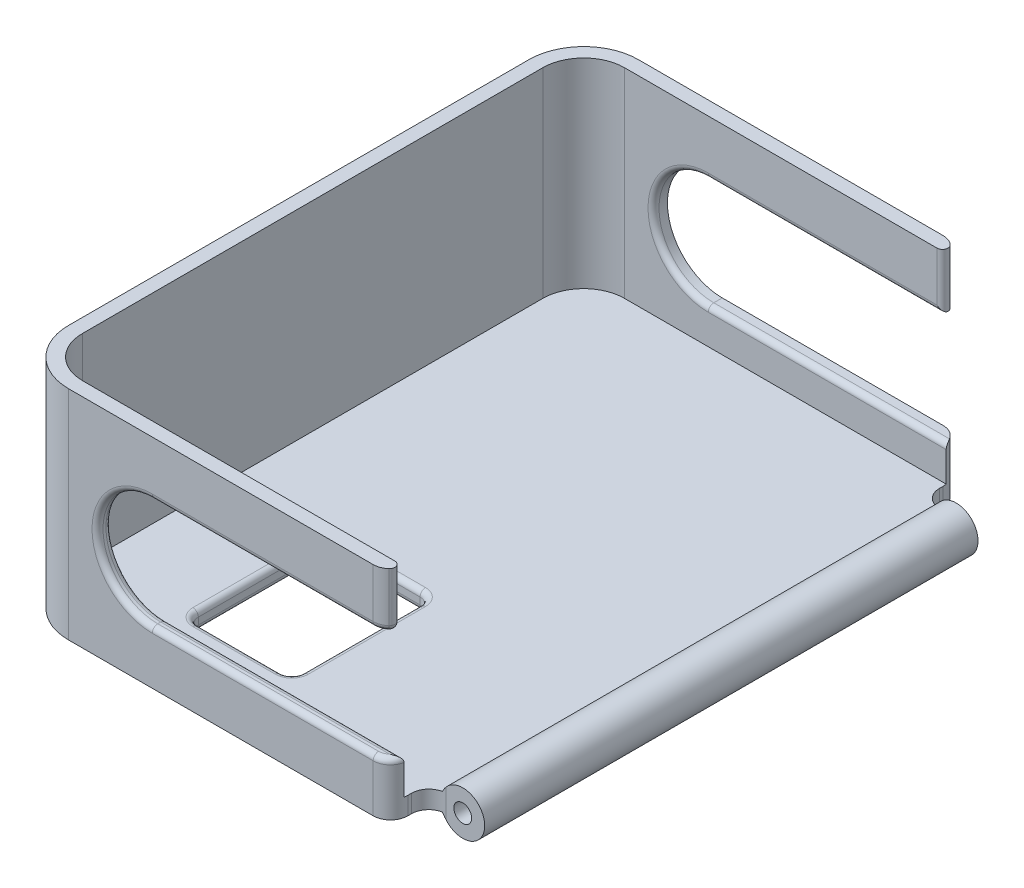
from build123d import *

# Parameters (mm, degrees)
SKETCH1_R                       = 4
BOSS_EXTRUDE1_DEPTH             = 45
SKETCH2_R                       = 1.625
BOSS_EXTRUDE2_DEPTH             = 2
FILLET1_R                       = 1
FILLET1_OF_MIRROR1_R            = 1
BOSS_EXTRUDE3_REACH             = 49.339
BOSS_EXTRUDE3_DIRECTION_2_REACH = 49.339
SKETCH5_W                       = 68.734952121
SKETCH5_H                       = 6.985
BOSS_EXTRUDE4_DEPTH             = 3.25
FILLET2_R                       = 3.175
FILLET3_R                       = 10
BOSS_EXTRUDE5_DEPTH             = 36.449
SKETCH7_W                       = 19.05
SKETCH7_H                       = 25.4
CUT_EXTRUDE1_DEPTH              = 33.782
FILLET4_R                       = 2
CUT_EXTRUDE2_DEPTH              = 134.693288074
CUT_EXTRUDE3_DEPTH              = 99.825981407
CUT_EXTRUDE3_DEPTH_BACK         = 99.825981407
SKETCH13_R                      = 1.625
SKETCH14_W                      = 22.869052137
SKETCH14_H                      = 20
CUT_EXTRUDE4_DEPTH              = 134.693288074
FILLET5_R                       = 1


with BuildPart() as part:
    # Sketch1 → Boss-Extrude1 (new, symmetric)
    with BuildSketch(Plane.XY):
        with Locations(Location((0, 0, 0), (0, 0, 180))):
            Circle(SKETCH1_R)
    extrude(amount=BOSS_EXTRUDE1_DEPTH, both=True)

    # Sketch2 → Boss-Extrude2 (add)
    with BuildSketch(Plane.XY.offset(45)):
        Circle(SKETCH2_R)
    boss_extrude2 = extrude(amount=BOSS_EXTRUDE2_DEPTH)

    # Fillet1
    fillet1_edges = [part.edges().sort_by_distance(p)[0] for p in [
        (-1.625, 0, 47),
    ]]
    fillet(fillet1_edges, radius=FILLET1_R)

    # Mirror1: Boss-Extrude2 across plane
    add(boss_extrude2.mirror(Plane.XY))

    # Fillet1 of Mirror1
    fillet1_of_mirror1_edges = [part.edges().sort_by_distance(p)[0] for p in [
        (-1.625, 0, -47),
    ]]
    fillet(fillet1_of_mirror1_edges, radius=FILLET1_OF_MIRROR1_R)

    # Boss-Extrude3: up to this face of the body (flat: up to its plane)
    boss_extrude3_end = Plane(part.part.faces().sort_by_distance((3.886862915, 0, 45))[0])
    # Sketch3 → Boss-Extrude3 (add, up to the picked face)
    with BuildSketch(Plane.XY, mode=Mode.PRIVATE) as boss_extrude3_sk1:
        Polygon((0, 0), (0, 1.625), (-74.93, 1.625), (-74.93, -1.625), (0, -1.625), align=None)
    boss_extrude3_tool1 = split(extrude(boss_extrude3_sk1.sketch, amount=BOSS_EXTRUDE3_REACH, mode=Mode.PRIVATE), bisect_by=boss_extrude3_end, keep=Keep.BOTH, mode=Mode.PRIVATE)
    add(boss_extrude3_tool1.solids().sort_by(Axis((-37.465, 0, 0), (0, 0, 1)))[0])

    # Boss-Extrude3 direction 2: up to this face of the body (flat: up to its plane)
    boss_extrude3_direction_2_end = Plane(part.part.faces().sort_by_distance((3.886862915, 0, -45))[0])
    # Sketch3 → Boss-Extrude3 direction 2 (add, up to the picked face)
    with BuildSketch(Plane.XY, mode=Mode.PRIVATE) as boss_extrude3_direction_2_sk1:
        Polygon((0, 0), (0, 1.625), (-74.93, 1.625), (-74.93, -1.625), (0, -1.625), align=None)
    boss_extrude3_direction_2_tool1 = split(extrude(boss_extrude3_direction_2_sk1.sketch, amount=-BOSS_EXTRUDE3_DIRECTION_2_REACH, mode=Mode.PRIVATE), bisect_by=boss_extrude3_direction_2_end, keep=Keep.BOTH, mode=Mode.PRIVATE)
    add(boss_extrude3_direction_2_tool1.solids().sort_by(Axis((-37.465, 0, 0), (0, 0, -1)))[0])

    # Sketch5 → Boss-Extrude4 (add)
    with BuildSketch(Plane(origin=(0, 1.625, 0), x_dir=(1, 0, 0), z_dir=(0, 1, 0))):
        with Locations((-40.56252394, 48.4925)):
            Rectangle(SKETCH5_W, SKETCH5_H)
    boss_extrude4 = extrude(amount=-BOSS_EXTRUDE4_DEPTH)

    # Mirror2: Boss-Extrude4 across plane
    add(boss_extrude4.mirror(Plane.XY))

    # Fillet2
    # the kernel refuses this fillet: 3.175 mm, written as the material it adds along each edge
    with BuildSketch(Plane(origin=(-6.195047879, 1.625, -45), x_dir=(1, 0, 0), z_dir=(0, -1, 0))) as fillet2_piece_1_section:
        with BuildLine():
            CenterArc((FILLET2_R, -FILLET2_R), FILLET2_R, 90, 90)
            Line((0, -FILLET2_R), (0, 0))
            Line((0, 0), (FILLET2_R, 0))
        make_face()
    fillet2_piece_1 = extrude(amount=3.25, mode=Mode.PRIVATE)
    fillet2_piece_1 = fillet2_piece_1 - Plane(origin=(0, 0, -45.745349648), x_dir=(-1, 0, 0), z_dir=(0, 0, 1)) * Cylinder(4, 20, mode=Mode.PRIVATE)
    add(fillet2_piece_1)
    with BuildSketch(Plane(origin=(-6.195047879, 9.5625, -45), x_dir=(1, 0, 0), z_dir=(0, -1, 0))) as fillet2_piece_2_section:
        with BuildLine():
            CenterArc((FILLET2_R, -FILLET2_R), FILLET2_R, 90, 90)
            Line((0, -FILLET2_R), (0, 0))
            Line((0, 0), (FILLET2_R, 0))
        make_face()
    fillet2_piece_2 = extrude(amount=11.1875, mode=Mode.PRIVATE)
    fillet2_piece_2 = split(fillet2_piece_2, bisect_by=Plane(origin=(-3.269448726, 1.625, -44.97522317), z_dir=(0, 1, 0)), keep=Keep.TOP, mode=Mode.PRIVATE)
    fillet2_piece_2 = fillet2_piece_2 & Plane(origin=(0, 0, -44.97522317), x_dir=(-1, 0, 0), z_dir=(0, 0, 1)) * Cylinder(4, 36, mode=Mode.PRIVATE)
    add(fillet2_piece_2)
    with BuildSketch(Plane(origin=(-6.195047879, 1.625, -45), x_dir=(1, 0, 0), z_dir=(0, -1, 0))) as fillet2_piece_3_section:
        with BuildLine():
            CenterArc((FILLET2_R, -FILLET2_R), FILLET2_R, 90, 90)
            Line((0, -FILLET2_R), (0, 0))
            Line((0, 0), (FILLET2_R, 0))
        make_face()
    fillet2_piece_3 = extrude(amount=3.25, mode=Mode.PRIVATE)
    fillet2_piece_3 = fillet2_piece_3 & Plane(origin=(0, 0, -44.99635319), x_dir=(-1, 0, 0), z_dir=(0, 0, 1)) * Cylinder(4, 20, mode=Mode.PRIVATE)
    add(fillet2_piece_3)
    with BuildSketch(Plane(origin=(-6.195047879, 1.625, -45), x_dir=(1, 0, 0), z_dir=(0, -1, 0))) as fillet2_piece_4_section:
        with BuildLine():
            CenterArc((FILLET2_R, -FILLET2_R), FILLET2_R, 90, 90)
            Line((0, -FILLET2_R), (0, 0))
            Line((0, 0), (FILLET2_R, 0))
        make_face()
    fillet2_piece_4 = extrude(amount=11.1875, mode=Mode.PRIVATE)
    fillet2_piece_4 = split(fillet2_piece_4, bisect_by=Plane(origin=(-3.269448726, -1.625, -44.97522317), z_dir=(0, -1, 0)), keep=Keep.TOP, mode=Mode.PRIVATE)
    fillet2_piece_4 = fillet2_piece_4 & Plane(origin=(0, 0, -44.97522317), x_dir=(-1, 0, 0), z_dir=(0, 0, 1)) * Cylinder(4, 36, mode=Mode.PRIVATE)
    add(fillet2_piece_4)
    with BuildSketch(Plane(origin=(-6.195047879, 1.625, 45), x_dir=(1, 0, 0), z_dir=(0, -1, 0))) as fillet2_piece_5_section:
        with BuildLine():
            CenterArc((FILLET2_R, FILLET2_R), FILLET2_R, 180, 90)
            Line((0, FILLET2_R), (0, 0))
            Line((0, 0), (FILLET2_R, 0))
        make_face()
    fillet2_piece_5 = extrude(amount=3.25, mode=Mode.PRIVATE)
    fillet2_piece_5 = fillet2_piece_5 - Plane(origin=(0, 0, 45.745349648), x_dir=(-1, 0, 0), z_dir=(0, 0, 1)) * Cylinder(4, 20, mode=Mode.PRIVATE)
    add(fillet2_piece_5)
    with BuildSketch(Plane(origin=(-6.195047879, 9.5625, 45), x_dir=(1, 0, 0), z_dir=(0, -1, 0))) as fillet2_piece_6_section:
        with BuildLine():
            CenterArc((FILLET2_R, FILLET2_R), FILLET2_R, 180, 90)
            Line((0, FILLET2_R), (0, 0))
            Line((0, 0), (FILLET2_R, 0))
        make_face()
    fillet2_piece_6 = extrude(amount=11.1875, mode=Mode.PRIVATE)
    fillet2_piece_6 = fillet2_piece_6 & Plane(origin=(0, 0, 44.97522317), x_dir=(-1, 0, 0), z_dir=(0, 0, 1)) * Cylinder(4, 36, mode=Mode.PRIVATE)
    fillet2_piece_6 = split(fillet2_piece_6, bisect_by=Plane(origin=(-3.269448726, 1.625, 44.97522317), z_dir=(0, 1, 0)), keep=Keep.TOP, mode=Mode.PRIVATE)
    add(fillet2_piece_6)
    with BuildSketch(Plane(origin=(-6.195047879, 1.625, 45), x_dir=(1, 0, 0), z_dir=(0, -1, 0))) as fillet2_piece_7_section:
        with BuildLine():
            CenterArc((FILLET2_R, FILLET2_R), FILLET2_R, 180, 90)
            Line((0, FILLET2_R), (0, 0))
            Line((0, 0), (FILLET2_R, 0))
        make_face()
    fillet2_piece_7 = extrude(amount=3.25, mode=Mode.PRIVATE)
    fillet2_piece_7 = fillet2_piece_7 & Plane(origin=(0, 0, 44.99635319), x_dir=(-1, 0, 0), z_dir=(0, 0, 1)) * Cylinder(4, 20, mode=Mode.PRIVATE)
    add(fillet2_piece_7)
    with BuildSketch(Plane(origin=(-6.195047879, 1.625, 45), x_dir=(1, 0, 0), z_dir=(0, -1, 0))) as fillet2_piece_8_section:
        with BuildLine():
            CenterArc((FILLET2_R, FILLET2_R), FILLET2_R, 180, 90)
            Line((0, FILLET2_R), (0, 0))
            Line((0, 0), (FILLET2_R, 0))
        make_face()
    fillet2_piece_8 = extrude(amount=11.1875, mode=Mode.PRIVATE)
    fillet2_piece_8 = fillet2_piece_8 & Plane(origin=(0, 0, 44.97522317), x_dir=(-1, 0, 0), z_dir=(0, 0, 1)) * Cylinder(4, 36, mode=Mode.PRIVATE)
    fillet2_piece_8 = split(fillet2_piece_8, bisect_by=Plane(origin=(-3.269448726, -1.625, 44.97522317), z_dir=(0, -1, 0)), keep=Keep.TOP, mode=Mode.PRIVATE)
    add(fillet2_piece_8)
    # the kernel refuses this fillet: 3.175 mm, written as the material it takes off along each edge
    with BuildSketch(Plane(origin=(-6.195047879, 9.5625, -51.985), x_dir=(0, 0, 1), z_dir=(0, -1, 0)), Plane(origin=(-6.195047879, 9.5625, 51.985), x_dir=(-1, 0, 0), z_dir=(0, -1, 0))) as fillet2_2_piece_1:
        with BuildLine():
            CenterArc((FILLET2_R, FILLET2_R), FILLET2_R, 180, 90)
            Line((0, FILLET2_R), (0, 0))
            Line((0, 0), (FILLET2_R, 0))
        make_face()
    extrude(amount=19.125, mode=Mode.SUBTRACT)

    # Fillet3
    fillet3_edges = [part.edges().sort_by_distance(p)[0] for p in [
        (-74.93, 0, -51.985),
        (-74.93, 0, 51.985),
    ]]
    fillet(fillet3_edges, radius=FILLET3_R)

    # Sketch6 → Boss-Extrude5 (add)
    with BuildSketch(Plane(origin=(0, 1.625, 0), x_dir=(1, 0, 0), z_dir=(0, 1, 0))):
        with BuildLine():
            Line((-9.370047879, 49.445), (-64.93, 49.445))
            ThreePointArc((-64.93, 49.445), (-70.205016588, 47.260016588), (-72.39, 41.985))
            Line((-72.39, 41.985), (-72.39, -41.985))
            ThreePointArc((-72.39, -41.985), (-70.205016588, -47.260016588), (-64.93, -49.445))
            Line((-64.93, -49.445), (-9.370047879, -49.445))
            Line((-9.370047879, -49.445), (-6.259195906, -49.445))
            ThreePointArc((-6.259195906, -49.445), (-7.362001565, -51.269344425), (-9.370047879, -51.985))
            Line((-9.370047879, -51.985), (-64.93, -51.985))
            ThreePointArc((-64.93, -51.985), (-72.001067812, -49.056067812), (-74.93, -41.985))
            Line((-74.93, -41.985), (-74.93, 41.985))
            ThreePointArc((-74.93, 41.985), (-72.001067812, 49.056067812), (-64.93, 51.985))
            Line((-64.93, 51.985), (-9.370047879, 51.985))
            ThreePointArc((-9.370047879, 51.985), (-7.362001565, 51.269344425), (-6.259195906, 49.445))
            Line((-6.259195906, 49.445), (-9.370047879, 49.445))
        make_face()
    extrude(amount=BOSS_EXTRUDE5_DEPTH)

    # Sketch7 → Cut-Extrude1 (cut)
    with BuildSketch(Plane.XZ.offset(1.625)):
        with Locations((-44.930047879, 28.085)):
            Rectangle(SKETCH7_W, SKETCH7_H)
    extrude(amount=-CUT_EXTRUDE1_DEPTH, mode=Mode.SUBTRACT)

    # Fillet4
    fillet4_edges = [part.edges().sort_by_distance(p)[0] for p in [
        (-35.405047879, 0, 40.785),
        (-35.405047879, 0, 15.385),
        (-54.455047879, 0, 15.385),
        (-54.455047879, 0, 40.785),
    ]]
    fillet(fillet4_edges, radius=FILLET4_R)

    # Sketch9 → Cut-Extrude2 (cut, through all)
    with BuildSketch(Plane(origin=(0, 0, -51.985), x_dir=(-1, 0, 0), z_dir=(0, 0, -1))):
        with BuildLine():
            Line((49.65002394, 8.074), (24.65002394, 8.074))
            ThreePointArc((24.65002394, 8.074), (14.65002394, 18.074), (24.65002394, 28.074))
            Line((24.65002394, 28.074), (49.65002394, 28.074))
            ThreePointArc((49.65002394, 28.074), (59.65002394, 18.074), (49.65002394, 8.074))
        make_face()
    extrude(amount=-CUT_EXTRUDE2_DEPTH, mode=Mode.SUBTRACT)

    # Sketch13 → Cut-Extrude3 (cut, two sides: drawn at the far end of the back side and taken through both)
    with BuildSketch(Plane.XY.offset(-CUT_EXTRUDE3_DEPTH_BACK)):
        Circle(SKETCH13_R)
    extrude(amount=CUT_EXTRUDE3_DEPTH + CUT_EXTRUDE3_DEPTH_BACK, mode=Mode.SUBTRACT)

    # Sketch14 → Cut-Extrude4 (cut, through all)
    with BuildSketch(Plane(origin=(0, 0, -51.985), x_dir=(-1, 0, 0), z_dir=(0, 0, -1))):
        with Locations((13.215497872, 18.074)):
            Rectangle(SKETCH14_W, SKETCH14_H)
    extrude(amount=-CUT_EXTRUDE4_DEPTH, mode=Mode.SUBTRACT)

    # Fillet5
    fillet5_edges = [part.edges().sort_by_distance(p)[0] for p in [
        (-53.869261442, 1.625, 40.199213562),
        (-44.930047879, 1.625, 40.785),
        (-35.990834317, 1.625, 40.199213562),
        (-35.405047879, 1.625, 28.085),
        (-35.990834317, 1.625, 15.970786438),
        (-44.930047879, 1.625, 15.385),
        (-53.869261442, 1.625, 15.970786438),
        (-53.869261442, -1.625, 40.199213562),
        (-44.930047879, -1.625, 40.785),
        (-35.990834317, -1.625, 40.199213562),
        (-35.405047879, -1.625, 28.085),
        (-35.990834317, -1.625, 15.970786438),
        (-44.930047879, -1.625, 15.385),
        (-53.869261442, -1.625, 15.970786438),
        (-37.15002394, 8.074, -49.445),
        (-59.65002394, 18.074, -49.445),
        (-37.15002394, 8.074, 49.445),
        (-59.65002394, 18.074, 49.445),
        (-59.65002394, 18.074, 51.985),
        (-37.15002394, 8.074, 51.985),
        (-54.455047879, 1.625, 28.085),
        (-54.455047879, -1.625, 28.085),
        (-37.15002394, 28.074, -49.445),
        (-37.15002394, 28.074, 49.445),
        (-37.15002394, 28.074, 51.985),
        (-7.362001565, 8.074, 51.269344425),
        (-7.362001565, 28.074, 51.269344425),
        (-6.259195906, 33.074, 49.445),
        (-6.259195906, 33.074, -49.445),
    ]]
    fillet(fillet5_edges, radius=FILLET5_R)


solid = part.part
